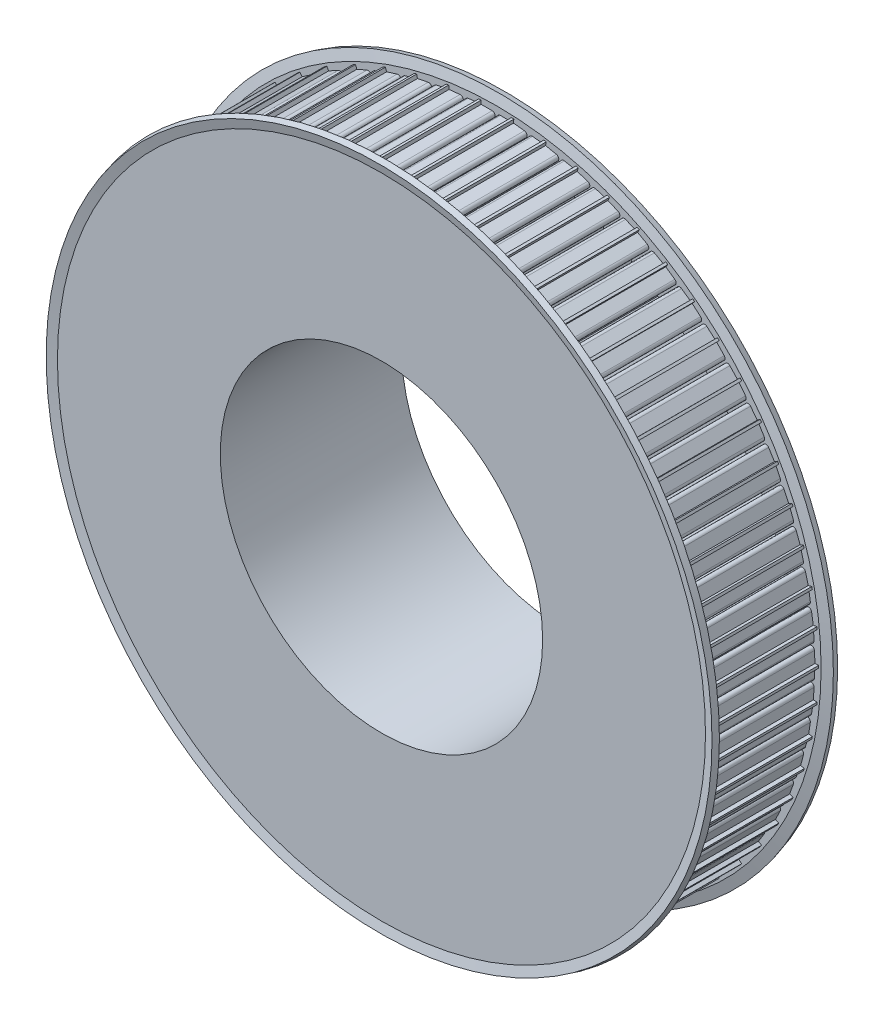
from build123d import *

# Parameters (mm, degrees)
CUT_EXTRUDE1_DEPTH = 122.757956619
CIRPATTERN1_COUNT  = 62


with BuildPart() as part:
    # Sketch1 → Revolve1 (revolve)
    with BuildSketch(Plane(origin=(0, 0, 0), x_dir=(0, 0, -1), z_dir=(1, 0, 0))):
        Polygon((0, 40), (0, 80), (30, 80), (30, 55.5), (45, 55.5), (45, 40), align=None)
    revolve(axis=Axis((0, 0, 55), (0, 0, -1)))

    # Sketch2 → Cut-Extrude1 (cut, through all)
    with BuildSketch(Plane.XY):
        with BuildLine():
            Line((1.015163111, 79), (3.75, 79))
            Line((3.75, 79), (3.75, 81))
            Line((3.75, 81), (-3.75, 81))
            Line((-3.75, 81), (-3.75, 79))
            Line((-3.75, 79), (-1.015163111, 79))
            ThreePointArc((-1.015163111, 79), (-0.272197178, 78.352477422), (-0.812130489, 77.528004325))
            ThreePointArc((-0.812130489, 77.528004325), (-2.992963638, 74.845371728), (-1.198957881, 71.890021627))
            Line((-1.198957881, 71.890021627), (1.198957881, 71.890021627))
            ThreePointArc((1.198957881, 71.890021627), (2.992963638, 74.845371728), (0.812130489, 77.528004325))
            ThreePointArc((0.812130489, 77.528004325), (0.272197178, 78.352477422), (1.015163111, 79))
        make_face()
    cut_extrude1 = extrude(amount=-CUT_EXTRUDE1_DEPTH, mode=Mode.SUBTRACT)

    # CirPattern1: Cut-Extrude1 ×62 about axis
    cirpattern1_axis = Axis((0, 0, 55), (0, 0, -1))
    for i in range(1, CIRPATTERN1_COUNT):
        add(cut_extrude1.rotate(cirpattern1_axis, i * 360 / CIRPATTERN1_COUNT), mode=Mode.SUBTRACT)

    # Sketch3 → Revolve3 (revolve)
    with BuildSketch(Plane(origin=(0, 0, 0), x_dir=(0, 0, -1), z_dir=(1, 0, 0))):
        Polygon((0, 80.414582296), (0, 71.837277532), (1.5, 71.837277532), (1.5, 80.612061042), (0.856921938, 83.012061042), (-0.591966801, 82.623832474), align=None)
        Polygon((30.591966801, 82.623832474), (29.143078062, 83.012061042), (28.5, 80.612061042), (28.5, 71.837277532), (30, 71.837277532), (30, 80.414582296), align=None)
    revolve(axis=Axis((0, 0, 55), (0, 0, -1)))


solid = part.part
